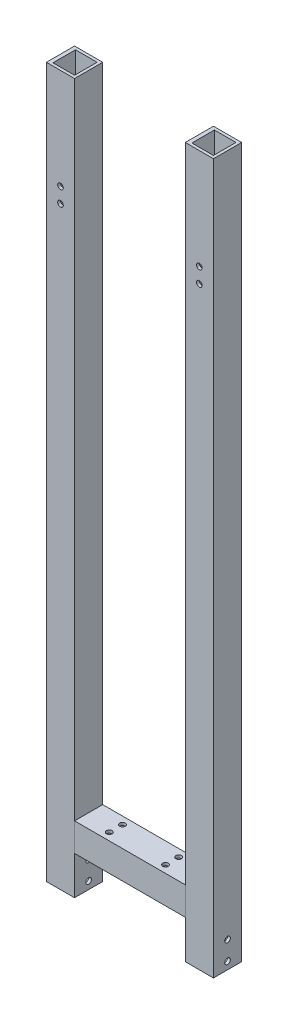
from build123d import *

# Parameters (mm, degrees)
MEMBER_START                     = -357.5
MEMBER_15_15_1_5_1_OUTLINE_W     = 59
MEMBER_15_15_1_5_1_OUTLINE_H     = 1.5
MEMBER_15_15_1_5_1_OUTLINE_H_2   = 2
MEMBER_15_15_1_5_1_DEPTH         = 15
MEMBER_15_15_1_5_1_2_OUTLINE_W   = 59
MEMBER_15_15_1_5_1_2_OUTLINE_H   = 11.5
MEMBER_15_15_1_5_1_2_DEPTH       = 1.5
MEMBER_START_2                   = -344
MEMBER_15_15_1_5_1_3_OUTLINE_W   = 59
MEMBER_15_15_1_5_1_3_OUTLINE_H   = 11.5
MEMBER_15_15_1_5_1_3_DEPTH       = 1.5
MEMBER_START_3                   = -7.5
MEMBER_15_15_1_5_1_4_OUTLINE_W   = 1.5
MEMBER_15_15_1_5_1_4_OUTLINE_H   = 378
MEMBER_15_15_1_5_1_4_OUTLINE_W_2 = 2
MEMBER_15_15_1_5_1_4_DEPTH       = 15
MEMBER_15_15_1_5_1_5_OUTLINE_W   = 11.5
MEMBER_15_15_1_5_1_5_OUTLINE_H   = 378
MEMBER_15_15_1_5_1_5_DEPTH       = 1.5
MEMBER_START_4                   = 6
MEMBER_15_15_1_5_1_6_OUTLINE_W   = 11.5
MEMBER_15_15_1_5_1_6_OUTLINE_H   = 378
MEMBER_15_15_1_5_1_6_DEPTH       = 1.5
MEMBER_15_15_1_5_1_7_OUTLINE_W   = 1.5
MEMBER_15_15_1_5_1_7_OUTLINE_H   = 378
MEMBER_15_15_1_5_1_7_OUTLINE_W_2 = 2
MEMBER_15_15_1_5_1_7_DEPTH       = 15
MEMBER_15_15_1_5_1_8_OUTLINE_W   = 11.5
MEMBER_15_15_1_5_1_8_OUTLINE_H   = 378
MEMBER_15_15_1_5_1_8_DEPTH       = 1.5
MEMBER_15_15_1_5_1_9_OUTLINE_W   = 11.5
MEMBER_15_15_1_5_1_9_OUTLINE_H   = 378
MEMBER_15_15_1_5_1_9_DEPTH       = 1.5
SKETCH_2_R                       = 1.5
CUT_EXTRUDE_1_DEPTH              = 389.40861216
SKETCH_4_R                       = 1.5
CUT_EXTRUDE_2_DEPTH              = 15
SKETCH_5_R                       = 1.5
CUT_EXTRUDE_3_DEPTH              = 387.977066504


# Read off the part's stored shape, not the designer's step: 方形管 15 ×15× 1.5(1)
with BuildPart() as part:
    # Member 15 _15_ 1.5_1 outline → Member 15 _15_ 1.5_1 (new body)
    with BuildSketch(Plane(origin=(0, 0, 0), x_dir=(1, 0, 0), z_dir=(0, 1, 0)).offset(MEMBER_START)):
        with Locations((37, 6.75)):
            Rectangle(MEMBER_15_15_1_5_1_OUTLINE_W, MEMBER_15_15_1_5_1_OUTLINE_H)
        with Locations((37, -6.5)):
            Rectangle(MEMBER_15_15_1_5_1_OUTLINE_W, MEMBER_15_15_1_5_1_OUTLINE_H_2)
    extrude(amount=MEMBER_15_15_1_5_1_DEPTH)

    # Member 15 _15_ 1.5_1 2 outline → Member 15 _15_ 1.5_1 2 (add)
    with BuildSketch(Plane(origin=(0, 0, 0), x_dir=(1, 0, 0), z_dir=(0, 1, 0)).offset(MEMBER_START)):
        with Locations((37, 0.25)):
            Rectangle(MEMBER_15_15_1_5_1_2_OUTLINE_W, MEMBER_15_15_1_5_1_2_OUTLINE_H)
    extrude(amount=MEMBER_15_15_1_5_1_2_DEPTH)

    # Member 15 _15_ 1.5_1 3 outline → Member 15 _15_ 1.5_1 3 (add)
    with BuildSketch(Plane(origin=(0, 0, 0), x_dir=(1, 0, 0), z_dir=(0, 1, 0)).offset(MEMBER_START_2)):
        with Locations((37, 0.25)):
            Rectangle(MEMBER_15_15_1_5_1_3_OUTLINE_W, MEMBER_15_15_1_5_1_3_OUTLINE_H)
    extrude(amount=MEMBER_15_15_1_5_1_3_DEPTH)

    # 草图4 → 切除-拉伸2 (cut)
    with BuildSketch(Plane(origin=(0, -342.5, 0), x_dir=(1, 0, 0), z_dir=(0, 1, 0))):
        with Locations(Location((22, 3.5, 0), (0, 0, 270))):
            Circle(SKETCH_4_R)
        with Locations(Location((22, -3.5, 0), (0, 0, 270))):
            Circle(SKETCH_4_R)
        with Locations(Location((52, -3.5, 0), (0, 0, 270))):
            Circle(SKETCH_4_R)
        with Locations(Location((52, 3.5, 0), (0, 0, 270))):
            Circle(SKETCH_4_R)
    extrude(amount=-CUT_EXTRUDE_2_DEPTH, mode=Mode.SUBTRACT)


with BuildPart() as body_2:
    # Member 15 _15_ 1.5_1 4 outline → Member 15 _15_ 1.5_1 4 (new body)
    with BuildSketch(Plane.XY.offset(MEMBER_START_3)):
        with Locations((80.75, -189)):
            Rectangle(MEMBER_15_15_1_5_1_4_OUTLINE_W, MEMBER_15_15_1_5_1_4_OUTLINE_H)
        with Locations((67.5, -189)):
            Rectangle(MEMBER_15_15_1_5_1_4_OUTLINE_W_2, MEMBER_15_15_1_5_1_4_OUTLINE_H)
    extrude(amount=MEMBER_15_15_1_5_1_4_DEPTH)

    # Member 15 _15_ 1.5_1 5 outline → Member 15 _15_ 1.5_1 5 (add)
    with BuildSketch(Plane.XY.offset(MEMBER_START_3)):
        with Locations((74.25, -189)):
            Rectangle(MEMBER_15_15_1_5_1_5_OUTLINE_W, MEMBER_15_15_1_5_1_5_OUTLINE_H)
    extrude(amount=MEMBER_15_15_1_5_1_5_DEPTH)

    # Member 15 _15_ 1.5_1 6 outline → Member 15 _15_ 1.5_1 6 (add)
    with BuildSketch(Plane.XY.offset(MEMBER_START_4)):
        with Locations((74.25, -189)):
            Rectangle(MEMBER_15_15_1_5_1_6_OUTLINE_W, MEMBER_15_15_1_5_1_6_OUTLINE_H)
    extrude(amount=MEMBER_15_15_1_5_1_6_DEPTH)


with BuildPart() as body_3:
    # Member 15 _15_ 1.5_1 7 outline → Member 15 _15_ 1.5_1 7 (new body)
    with BuildSketch(Plane.XY.offset(MEMBER_START_3)):
        with Locations((6.75, -189)):
            Rectangle(MEMBER_15_15_1_5_1_7_OUTLINE_W, MEMBER_15_15_1_5_1_7_OUTLINE_H)
        with Locations((-6.5, -189)):
            Rectangle(MEMBER_15_15_1_5_1_7_OUTLINE_W_2, MEMBER_15_15_1_5_1_7_OUTLINE_H)
    extrude(amount=MEMBER_15_15_1_5_1_7_DEPTH)

    # Member 15 _15_ 1.5_1 8 outline → Member 15 _15_ 1.5_1 8 (add)
    with BuildSketch(Plane.XY.offset(MEMBER_START_3)):
        with Locations((0.25, -189)):
            Rectangle(MEMBER_15_15_1_5_1_8_OUTLINE_W, MEMBER_15_15_1_5_1_8_OUTLINE_H)
    extrude(amount=MEMBER_15_15_1_5_1_8_DEPTH)

    # Member 15 _15_ 1.5_1 9 outline → Member 15 _15_ 1.5_1 9 (add)
    with BuildSketch(Plane.XY.offset(MEMBER_START_4)):
        with Locations((0.25, -189)):
            Rectangle(MEMBER_15_15_1_5_1_9_OUTLINE_W, MEMBER_15_15_1_5_1_9_OUTLINE_H)
    extrude(amount=MEMBER_15_15_1_5_1_9_DEPTH)


with BuildPart() as cut_extrude_1_tool:
    # 草图2 → 切除-拉伸1 (new, through all)
    with BuildSketch(Plane(origin=(81.5, 0, 0), x_dir=(0, 0, -1), z_dir=(1, 0, 0))):
        with Locations((0, -364)):
            Circle(SKETCH_2_R)
        with Locations((0, -374)):
            Circle(SKETCH_2_R)
    extrude(amount=-CUT_EXTRUDE_1_DEPTH)


with BuildPart() as body_2_1:
    add(body_2.part)

    # 切除-拉伸1: cut by cut_extrude_1_tool
    add(cut_extrude_1_tool.part, mode=Mode.SUBTRACT)


with BuildPart() as body_3_1:
    add(body_3.part)

    # 切除-拉伸1: cut by cut_extrude_1_tool
    add(cut_extrude_1_tool.part, mode=Mode.SUBTRACT)


with BuildPart() as cut_extrude_3_tool:
    # 草图5 → 切除-拉伸3 (new, through all)
    with BuildSketch(Plane.XY.offset(7.5)):
        with Locations((0, -53.5)):
            Circle(SKETCH_5_R)
        with Locations((0, -61.5)):
            Circle(SKETCH_5_R)
        with Locations((74, -61.5)):
            Circle(SKETCH_5_R)
        with Locations(Location((74, -53.5, 0), (0, 0, 270))):
            Circle(SKETCH_5_R)
    extrude(amount=-CUT_EXTRUDE_3_DEPTH)


with BuildPart() as body_2_2:
    add(body_2_1.part)

    # 切除-拉伸3: cut by cut_extrude_3_tool
    add(cut_extrude_3_tool.part, mode=Mode.SUBTRACT)


with BuildPart() as body_3_2:
    add(body_3_1.part)

    # 切除-拉伸3: cut by cut_extrude_3_tool
    add(cut_extrude_3_tool.part, mode=Mode.SUBTRACT)


solid = Compound([part.part, body_2_2.part, body_3_2.part])
